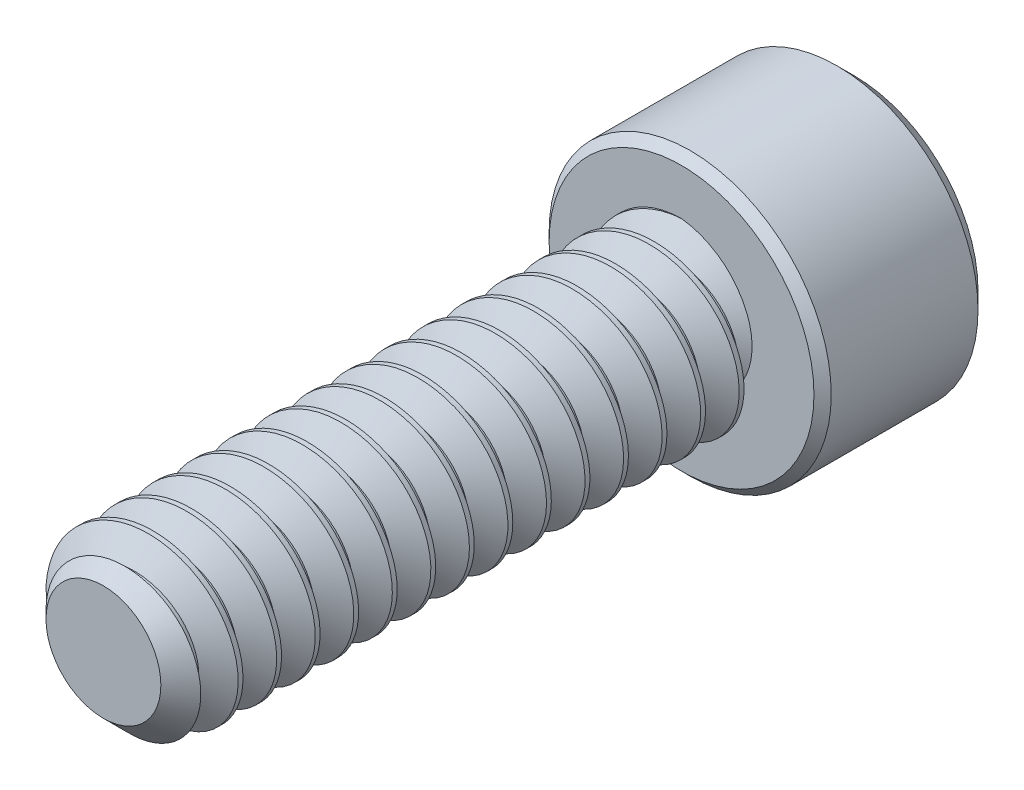
from build123d import *

# Parameters (mm, degrees)
SKETCH1_R          = 1.4224
EXTRUDE1_DEPTH     = 9.525
CHAMFER3_SIZE      = 0.47625
CUT_SWEEP1_PITCH   = 0.635
SKETCH6_R          = 2.3241
EXTRUDE2_DEPTH     = 2.8448
CUT_EXTRUDE1_DEPTH = 1.7859375
SKETCH8_R          = 1.374815329
CUT_EXTRUDE2_DEPTH = 0.28448
CUT_EXTRUDE2_DRAFT = -45
CHAMFER1_SIZE      = 0.28448
CHAMFER2_SIZE      = 0.14224


with BuildPart() as part:
    # Sketch1 → Extrude1 (new body)
    with BuildSketch(Plane.XY):
        Circle(SKETCH1_R)
    extrude(amount=-EXTRUDE1_DEPTH)

    # Chamfer3
    chamfer3_edges = [part.edges().sort_by_distance(p)[0] for p in [
        (-1.4224, 0, 0),
    ]]
    chamfer(chamfer3_edges, length=CHAMFER3_SIZE)

    # Cut-Sweep1: the profile of Sketch3 profile screwed along a right-hand helix of 16 turns, 6 arcs to a turn; built about Z, then put on its axis
    cut_sweep1_z = Axis((0, 0, 0), (0, 0, 1))
    cut_sweep1_corners = [(1.4227, 0, -0.555798205), (1.009955401, 0, -0.3175), (1.009955401, 0, -0.238125), (1.4227, 0, 0.000173205)]
    with BuildLine(mode=Mode.PRIVATE) as cut_sweep1_profile:
        Line(cut_sweep1_corners[0], cut_sweep1_corners[1])
        Line(cut_sweep1_corners[1], cut_sweep1_corners[2])
        Line(cut_sweep1_corners[2], cut_sweep1_corners[3])
        Line(cut_sweep1_corners[3], cut_sweep1_corners[0])
    cut_sweep1_cap = Face(cut_sweep1_profile.wire())
    cut_sweep1_turn_angles = [0, 30, 60, 90, 120, 150, 180, 210, 240, 270, 300, 330, 360]
    cut_sweep1_turn_weights = [1, 0.8660254037844387, 1, 0.8660254037844387, 1, 0.8660254037844387, 1, 0.8660254037844387, 1, 0.8660254037844387, 1, 0.8660254037844387, 1]
    cut_sweep1_turn_rails = [Edge.make_bspline([Vector(p[0], p[1], 0).rotate(cut_sweep1_z, cut_sweep1_turn_angles[k]) / cut_sweep1_turn_weights[k] + Vector(0, 0, p[2] + CUT_SWEEP1_PITCH * cut_sweep1_turn_angles[k] / 360) for k in range(13)], [0, 0, 0, 1, 1, 2, 2, 3, 3, 4, 4, 5, 5, 6, 6, 6], 2, cut_sweep1_turn_weights) for p in cut_sweep1_corners]
    cut_sweep1_turn_sides = [Face.make_surface_from_curves(cut_sweep1_turn_rails[p[0]], cut_sweep1_turn_rails[p[1]]) for p in [(0, 1), (1, 2), (2, 3), (3, 0)]]
    cut_sweep1 = Plane(origin=(0, 0, 0), x_dir=(0, 1, 0), z_dir=(0, 0, -1)) * Solid(Shell([*[p.moved(Location((0, 0, CUT_SWEEP1_PITCH * i))) for i in range(16) for p in cut_sweep1_turn_sides], cut_sweep1_cap, cut_sweep1_cap.rotate(cut_sweep1_z, 5760).moved(Location((0, 0, CUT_SWEEP1_PITCH * 5760 / 360)))]))
    add(cut_sweep1, mode=Mode.SUBTRACT)

    # Sketch6 → Extrude2 (add)
    with BuildSketch(Plane(origin=(0, 0, -9.525), x_dir=(-1, 0, 0), z_dir=(0, 0, -1))):
        Circle(SKETCH6_R)
    extrude(amount=EXTRUDE2_DEPTH)

    # Sketch7 → Cut-Extrude1 (cut)
    with BuildSketch(Plane(origin=(0, 0, -12.3698), x_dir=(-1, 0, 0), z_dir=(0, 0, -1))):
        Polygon((0, 1.374815329), (-1.190625, 0.687407664), (-1.190625, -0.687407664), (0, -1.374815329), (1.190625, -0.687407664), (1.190625, 0.687407664), align=None)
    extrude(amount=-CUT_EXTRUDE1_DEPTH, mode=Mode.SUBTRACT)


with BuildPart() as cut_extrude2_tool:
    # Sketch8 → Cut-Extrude2 (with draft: the straight prism first)
    with BuildSketch(Plane(origin=(0, 0, -12.3698), x_dir=(-1, 0, 0), z_dir=(0, 0, -1))):
        Circle(SKETCH8_R)
    extrude(amount=-CUT_EXTRUDE2_DEPTH)
    # Cut-Extrude2: the draft: its side faces are tilted about the plane it starts from
    cut_extrude2_sides = [cut_extrude2_tool.faces().sort_by_distance(p)[0] for p in [
        (1.374815329, 0, -12.22756),
    ]]
    draft(cut_extrude2_sides, Plane(origin=(0, 0, -12.3698), x_dir=(-1, 0, 0), z_dir=(0, 0, -1)), CUT_EXTRUDE2_DRAFT)


with BuildPart() as part_1:
    add(part.part)

    # Cut-Extrude2: cut by cut_extrude2_tool
    add(cut_extrude2_tool.part, mode=Mode.SUBTRACT)

    # Chamfer1
    chamfer1_edges = [part_1.edges().sort_by_distance(p)[0] for p in [
        (2.3241, 0, -12.3698),
    ]]
    chamfer(chamfer1_edges, length=CHAMFER1_SIZE)

    # Chamfer2
    chamfer2_edges = [part_1.edges().sort_by_distance(p)[0] for p in [
        (2.3241, 0, -9.525),
    ]]
    chamfer(chamfer2_edges, length=CHAMFER2_SIZE)


solid = part_1.part
